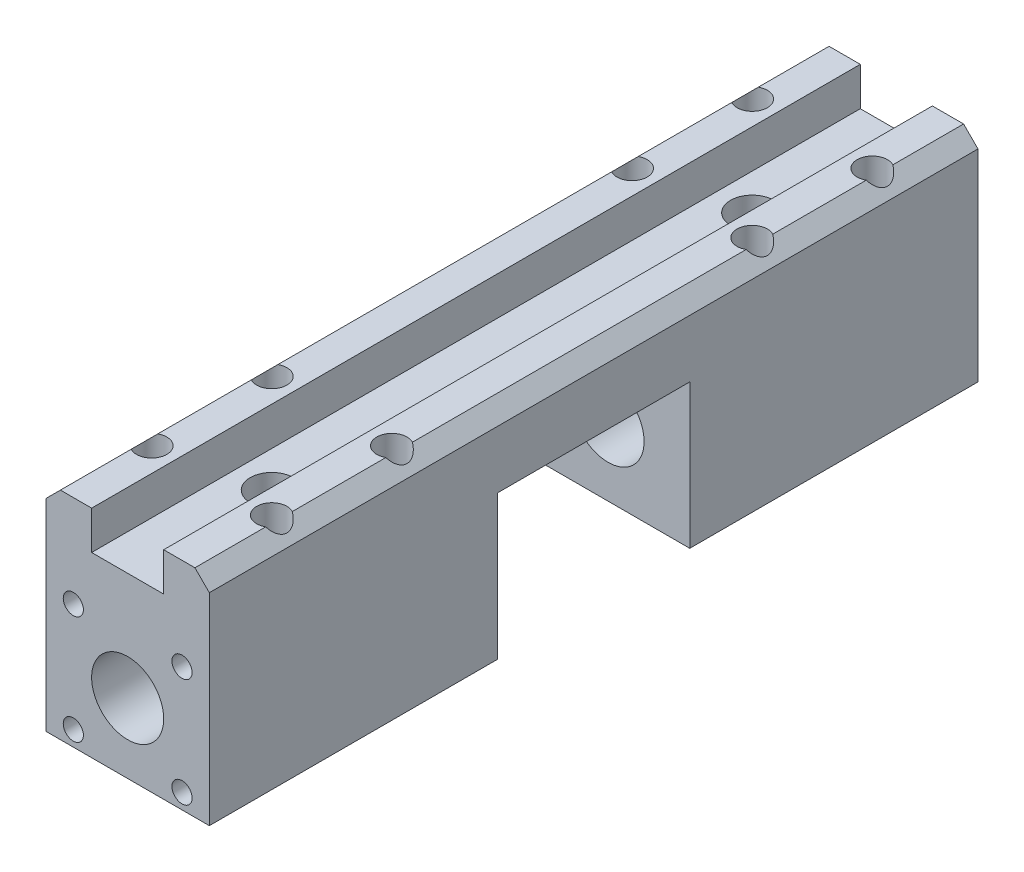
from build123d import *

# Parameters (mm, degrees)
SKETCH_1_W                  = 34
SKETCH_1_H                  = 160
EXTRUDE_330_DEPTH           = 45
HOLE_WIZARD_M3_AT_2_COUNT   = 2
HOLE_WIZARD_M3_AT_2_PITCH   = 25
HOLE_WIZARD_M3_AT_3_COUNT   = 2
HOLE_WIZARD_M3_AT_3_PITCH   = 35.355339059
HOLE_WIZARD_M3_AT_4_COUNT   = 2
HOLE_WIZARD_M3_AT_4_PITCH   = 25
HOLE_WIZARD_M3_AT_5_COUNT   = 2
HOLE_WIZARD_M3_AT_5_PITCH   = 125
HOLE_WIZARD_M3_AT_6_COUNT   = 2
HOLE_WIZARD_M3_AT_6_PITCH   = 100
HOLE_WIZARD_M3_AT_7_COUNT   = 2
HOLE_WIZARD_M3_AT_7_PITCH   = 103.07764064
HOLE_WIZARD_M3_AT_8_COUNT   = 2
HOLE_WIZARD_M3_AT_8_PITCH   = 127.47548784
SKETCH_7_W                  = 15
SKETCH_7_H                  = 160
CUT_EXTRUDE_1590_DEPTH      = 8
CHAMFER_1_SIZE              = 3
SKETCH_8_R                  = 7.5
CUT_EXTRUDE_1_DEPTH         = 168.074833533
HOLE_WIZARD_M6_D            = 9
HOLE_WIZARD_M6_CBORE_D      = 15
HOLE_WIZARD_M6_CBORE_DEPTH  = 28.6
SKETCH_10_W                 = 40
SKETCH_10_H                 = 30
CUT_EXTRUDE_3_DEPTH         = 98.88258272
HOLE_WIZARD_1204_AT_2_COUNT = 2
HOLE_WIZARD_1204_AT_2_PITCH = 22.627416999
HOLE_WIZARD_1204_AT_3_COUNT = 2
HOLE_WIZARD_1204_AT_3_PITCH = 32.000000001
HOLE_WIZARD_1204_AT_4_COUNT = 2
HOLE_WIZARD_1204_AT_4_PITCH = 22.627416999


with BuildPart() as part:
    # Эскиз1 → Extrude 330 (new body)
    with BuildSketch(Plane(origin=(0, 0, 0), x_dir=(1, 0, 0), z_dir=(0, 1, 0))):
        Rectangle(SKETCH_1_W, SKETCH_1_H)
    extrude(amount=EXTRUDE_330_DEPTH)

    # Эскиз3 → Каретки M3 (revolve, cut)
    with BuildSketch(Plane(origin=(-12.5, 45, 62.5), x_dir=(0, 0, 1), z_dir=(1, 0, 0))):
        Polygon((0, 0), (0, 45), (1.7, 45), (1.7, 28.45), (3.15, 27), (3.15, 0), align=None)
    hole_wizard_m3 = revolve(axis=Axis((-12.5, 51.35, 62.5), (0, -1, 0)), mode=Mode.SUBTRACT)

    # Каретки M3 at 2: Каретки M3 ×2
    with Locations(*[(i * HOLE_WIZARD_M3_AT_2_PITCH, 0, 0) for i in range(1, HOLE_WIZARD_M3_AT_2_COUNT)]):
        add(hole_wizard_m3, mode=Mode.SUBTRACT)

    # Каретки M3 at 3: Каретки M3 ×2
    with Locations(*[Vector(0.7071067811865475, 0, -0.7071067811865477) * (i * HOLE_WIZARD_M3_AT_3_PITCH) for i in range(1, HOLE_WIZARD_M3_AT_3_COUNT)]):
        add(hole_wizard_m3, mode=Mode.SUBTRACT)

    # Каретки M3 at 4: Каретки M3 ×2
    with Locations(*[(0, 0, -i * HOLE_WIZARD_M3_AT_4_PITCH) for i in range(1, HOLE_WIZARD_M3_AT_4_COUNT)]):
        add(hole_wizard_m3, mode=Mode.SUBTRACT)

    # Каретки M3 at 5: Каретки M3 ×2
    with Locations(*[(0, 0, -i * HOLE_WIZARD_M3_AT_5_PITCH) for i in range(1, HOLE_WIZARD_M3_AT_5_COUNT)]):
        add(hole_wizard_m3, mode=Mode.SUBTRACT)

    # Каретки M3 at 6: Каретки M3 ×2
    with Locations(*[(0, 0, -i * HOLE_WIZARD_M3_AT_6_PITCH) for i in range(1, HOLE_WIZARD_M3_AT_6_COUNT)]):
        add(hole_wizard_m3, mode=Mode.SUBTRACT)

    # Каретки M3 at 7: Каретки M3 ×2
    with Locations(*[Vector(0.2425356250363329, 0, -0.9701425001453319) * (i * HOLE_WIZARD_M3_AT_7_PITCH) for i in range(1, HOLE_WIZARD_M3_AT_7_COUNT)]):
        add(hole_wizard_m3, mode=Mode.SUBTRACT)

    # Каретки M3 at 8: Каретки M3 ×2
    with Locations(*[Vector(0.19611613513818404, 0, -0.9805806756909202) * (i * HOLE_WIZARD_M3_AT_8_PITCH) for i in range(1, HOLE_WIZARD_M3_AT_8_COUNT)]):
        add(hole_wizard_m3, mode=Mode.SUBTRACT)

    # Эскиз7 → Cut-Extrude 1590 (cut)
    with BuildSketch(Plane(origin=(0, 45, 0), x_dir=(1, 0, 0), z_dir=(0, 1, 0))):
        Rectangle(SKETCH_7_W, SKETCH_7_H)
    extrude(amount=-CUT_EXTRUDE_1590_DEPTH, mode=Mode.SUBTRACT)

    # Фаска1
    # the kernel refuses this chamfer: 3 mm, written as the material it takes off along each edge
    with BuildSketch(Plane(origin=(-17, 45, 87.715048964), x_dir=(0.9996219169112968, 0.02749587661058678, 0), z_dir=(0, 0, -1))) as chamfer_1_piece_1:
        Polygon((CHAMFER_1_SIZE * 0.999621916911, CHAMFER_1_SIZE * 0.0274958766106), (-CHAMFER_1_SIZE * 0.0274958766106, CHAMFER_1_SIZE * 0.999621916911), (0, 0), align=None)
    extrude(amount=175.430097928, mode=Mode.SUBTRACT)
    with BuildSketch(Plane(origin=(17, 45, -87.715048964), x_dir=(0.027495876610586768, -0.9996219169112968, 0), z_dir=(0, 0, 1))) as chamfer_1_piece_2:
        Polygon((CHAMFER_1_SIZE * 0.999621916911, -CHAMFER_1_SIZE * 0.0274958766106), (-CHAMFER_1_SIZE * 0.0274958766106, -CHAMFER_1_SIZE * 0.999621916911), (0, 0), align=None)
    extrude(amount=175.430097928, mode=Mode.SUBTRACT)

    # Эскиз8 → Вырез-Вытянуть1 (cut, through all)
    with BuildSketch(Plane.XY.offset(80)):
        with Locations((0, 14.5)):
            Circle(SKETCH_8_R)
    extrude(amount=-CUT_EXTRUDE_1_DEPTH, mode=Mode.SUBTRACT)

    # Верхняя плита M6 (through all)
    with Locations(Plane(origin=(0, 0, 0), x_dir=(-1, 0, 0), z_dir=(0, -1, 0))):
        with Locations((0, -50), (0, 50)):
            CounterBoreHole(HOLE_WIZARD_M6_D / 2, HOLE_WIZARD_M6_CBORE_D / 2, HOLE_WIZARD_M6_CBORE_DEPTH)

    # Эскиз10 → Вырез-Вытянуть3 (cut, through all)
    with BuildSketch(Plane(origin=(17, 0, 0), x_dir=(0, 0, -1), z_dir=(1, 0, 0))):
        with Locations((0, 15)):
            Rectangle(SKETCH_10_W, SKETCH_10_H)
    extrude(amount=-CUT_EXTRUDE_3_DEPTH, mode=Mode.SUBTRACT)

    # Эскиз12 → Гайка-1204 (revolve, cut)
    with BuildSketch(Plane(origin=(-11.313708499, 25.813708499, 20), x_dir=(0, 1, 0), z_dir=(1, 0, 0))):
        Polygon((0, 0), (0, 60), (2.1, 60), (2.1, 0.425), (2.525, 0), align=None)
    hole_wizard_1204 = revolve(axis=Axis((-11.313708499, 25.813708499, 13.65), (0, 0, 1)), mode=Mode.SUBTRACT)

    # Гайка-1204 at 2: Гайка-1204 ×2
    with Locations(*[(0, -i * HOLE_WIZARD_1204_AT_2_PITCH, 0) for i in range(1, HOLE_WIZARD_1204_AT_2_COUNT)]):
        add(hole_wizard_1204, mode=Mode.SUBTRACT)

    # Гайка-1204 at 3: Гайка-1204 ×2
    with Locations(*[Vector(0.7071067811865476, -0.7071067811865476, 0) * (i * HOLE_WIZARD_1204_AT_3_PITCH) for i in range(1, HOLE_WIZARD_1204_AT_3_COUNT)]):
        add(hole_wizard_1204, mode=Mode.SUBTRACT)

    # Гайка-1204 at 4: Гайка-1204 ×2
    with Locations(*[(i * HOLE_WIZARD_1204_AT_4_PITCH, 0, 0) for i in range(1, HOLE_WIZARD_1204_AT_4_COUNT)]):
        add(hole_wizard_1204, mode=Mode.SUBTRACT)


solid = part.part
